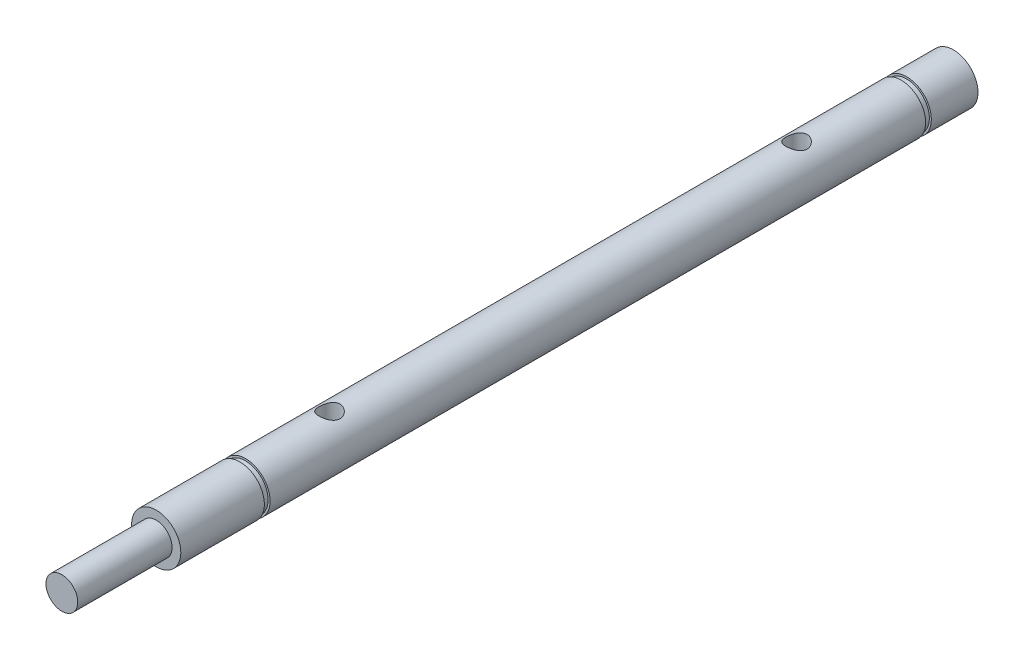
from build123d import *

# Parameters (mm, degrees)
F_6_32_TAPPED_HOLE1_D     = 2.7051
F_6_32_TAPPED_HOLE1_DEPTH = 9.398
F_6_32_TAPPED_HOLE1_TIP   = 0.81269403
SKETCH4_R                 = 2.05
BOSS_EXTRUDE1_DEPTH       = 6.35


with BuildPart() as part:
    # Sketch1 → Revolve1 (revolve)
    with BuildSketch(Plane(origin=(0, 0, 0), x_dir=(1, 0, 0), z_dir=(0, 1, 0))):
        Polygon((3.175, 93.769403682), (3.175, 99.795553682), (0, 99.795553682), (0, -9.017), (2.05, -9.017), (2.05, -3.175), (3.175, -3.175), (3.175, 7.62), (2.921, 7.62), (2.921, 8.3566), (3.175, 8.3566), (3.175, 93.032803682), (2.921, 93.032803682), (2.921, 93.769403682), align=None)
    revolve(axis=Axis((0, 0, 9.017), (0, 0, -1)))

    # #6-32 Tapped Hole1
    with Locations(Plane(origin=(0, -3.175, 0), x_dir=(-1, 0, 0), z_dir=(0, -1, 0))):
        with Locations((0, 79.530799572), (0, 19.205799572)):
            Hole(F_6_32_TAPPED_HOLE1_D / 2, depth=F_6_32_TAPPED_HOLE1_DEPTH)
            with Locations((0, 0, -(F_6_32_TAPPED_HOLE1_DEPTH + F_6_32_TAPPED_HOLE1_TIP / 2))):  # 118° drill point
                Cone(0, F_6_32_TAPPED_HOLE1_D / 2, F_6_32_TAPPED_HOLE1_TIP, mode=Mode.SUBTRACT)

    # Sketch4 → Boss-Extrude1 (add)
    with BuildSketch(Plane.XY.offset(9.017)):
        Circle(SKETCH4_R)
    extrude(amount=BOSS_EXTRUDE1_DEPTH)


solid = part.part
